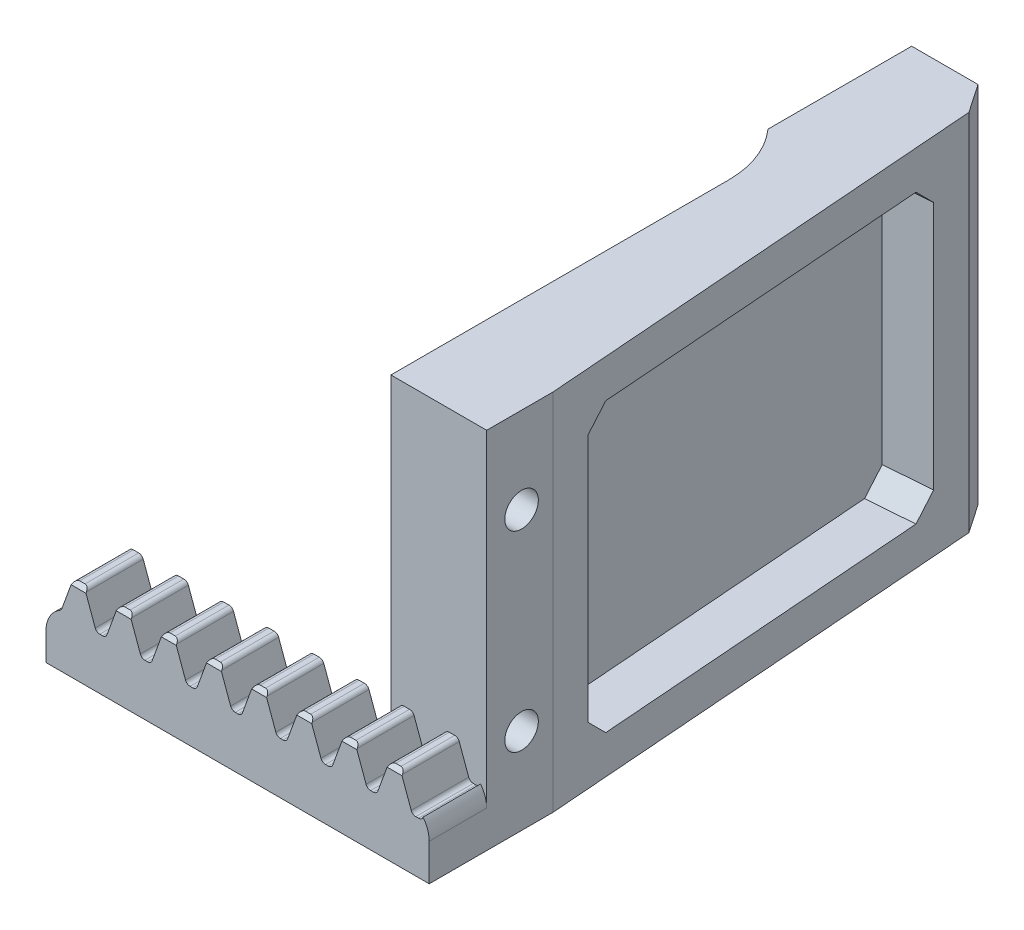
from build123d import *

# Parameters (mm, degrees)
BOSS_EXTRUDE1_DEPTH      = 7.5
BOSS_EXTRUDE1_DEPTH_BACK = 7.5
SKETCH3_W                = 200
SKETCH3_H                = 15
CUT_EXTRUDE1_DEPTH       = 101.560926806
FILLET1_R                = 0.503257554
LPATTERN1_COUNT          = 42
LPATTERN1_PITCH          = 4.71238898
FILLET1_OF_LPATTERN1_R   = 0.503257554
CUT_EXTRUDE2_DEPTH       = 101.560926806
CUT_EXTRUDE2_DEPTH_BACK  = 101.560926806
SKETCH5_W                = 4.71238898
SKETCH5_H                = 3.375
CUT_EXTRUDE3_DEPTH       = 101.560926806
CUT_EXTRUDE3_DEPTH_BACK  = 101.560926806
SKETCH6_W                = 13.890612777
SKETCH6_H                = 21.950597968
CUT_EXTRUDE6_DEPTH       = 101.560926806
CUT_EXTRUDE6_DEPTH_BACK  = 101.560926806
SKETCH8_W                = 175.100830171
SKETCH8_H                = 44.946806771
SKETCH9_W                = 55.501850732
SKETCH9_H                = 10.784038355
CUT_EXTRUDE7_DEPTH       = 101.560926806
SKETCH10_W               = 10
SKETCH10_H               = 38
BOSS_EXTRUDE2_DEPTH      = 6.9
SKETCH11_W               = 12.54
SKETCH11_H               = 38
BOSS_EXTRUDE3_DEPTH      = 50
SKETCH12_W               = 2.54
SKETCH12_H               = 35
CUT_EXTRUDE8_DEPTH       = 121.701325593
CHAMFER1_SIZE            = 3
CHAMFER1_SIZE2           = 1.816762814
FILLET2_R                = 10
SKETCH13_W               = 39.144192087
SKETCH13_H               = 30
CUT_EXTRUDE9_DEPTH       = 5
CHAMFER2_SIZE            = 2
SKETCH14_R               = 1.75
CUT_EXTRUDE10_DEPTH      = 78.944675893
SKETCH15_W               = 75.463673411
SKETCH15_H               = 29.481435093
CUT_EXTRUDE11_DEPTH      = 0.5
FILLET3_R                = 3
CUT_EXTRUDE12_DEPTH      = 78.944675893
CUT_EXTRUDE12_DEPTH_BACK = 78.944675893


with BuildPart() as part:
    # Sketch3 → Boss-Extrude1 (new, two sides: drawn at the far end of the back side and taken through both)
    with BuildSketch(Plane.XY.offset(-BOSS_EXTRUDE1_DEPTH_BACK)):
        Rectangle(SKETCH3_W, SKETCH3_H)
    extrude(amount=BOSS_EXTRUDE1_DEPTH + BOSS_EXTRUDE1_DEPTH_BACK)

    # Sketch4 → Cut-Extrude1 (cut, symmetric)
    with BuildSketch(Plane.XY):
        Polygon((-94.247779608, 7.5), (-94.247779608, 4.125), (-94.743432664, 4.125), (-95.971832204, 7.5), align=None)
        Polygon((-97.236115992, 7.5), (-98.464515532, 4.125), (-98.960168588, 4.125), (-98.960168588, 7.5), align=None)
    cut_extrude1 = extrude(amount=CUT_EXTRUDE1_DEPTH, both=True, mode=Mode.SUBTRACT)

    # Fillet1
    fillet1_edges = [part.edges().sort_by_distance(p)[0] for p in [
        (-95.971832204, 7.5, 0),
        (-94.743432664, 4.125, 0),
        (-97.236115992, 7.5, 0),
        (-98.464515532, 4.125, 0),
    ]]
    fillet(fillet1_edges, radius=FILLET1_R)

    # LPattern1: Cut-Extrude1 ×42
    with Locations(*[(i * LPATTERN1_PITCH, 0, 0) for i in range(1, LPATTERN1_COUNT)]):
        add(cut_extrude1, mode=Mode.SUBTRACT)

    # Fillet1 of LPattern1
    fillet1_of_lpattern1_edges = [part.edges().sort_by_distance(p)[0] for p in [
        (-91.259443224, 7.5, 0),
        (-90.031043683, 4.125, 0),
        (-92.523727011, 7.5, 0),
        (-93.752126552, 4.125, 0),
        (-86.547054243, 7.5, 0),
        (-85.318654703, 4.125, 0),
        (-87.811338031, 7.5, 0),
        (-89.039737571, 4.125, 0),
        (-81.834665263, 7.5, 0),
        (-80.606265722, 4.125, 0),
        (-83.09894905, 7.5, 0),
        (-84.327348591, 4.125, 0),
        (-77.122276283, 7.5, 0),
        (-75.893876742, 4.125, 0),
        (-78.38656007, 7.5, 0),
        (-79.614959611, 4.125, 0),
        (-72.409887302, 7.5, 0),
        (-71.181487762, 4.125, 0),
        (-73.67417109, 7.5, 0),
        (-74.90257063, 4.125, 0),
        (-67.697498322, 7.5, 0),
        (-66.469098781, 4.125, 0),
        (-68.961782109, 7.5, 0),
        (-70.19018165, 4.125, 0),
        (-62.985109342, 7.5, 0),
        (-61.756709801, 4.125, 0),
        (-64.249393129, 7.5, 0),
        (-65.47779267, 4.125, 0),
        (-58.272720361, 7.5, 0),
        (-57.04432082, 4.125, 0),
        (-59.537004149, 7.5, 0),
        (-60.765403689, 4.125, 0),
        (-53.560331381, 7.5, 0),
        (-52.33193184, 4.125, 0),
        (-54.824615168, 7.5, 0),
        (-56.053014709, 4.125, 0),
        (-48.8479424, 7.5, 0),
        (-47.61954286, 4.125, 0),
        (-50.112226188, 7.5, 0),
        (-51.340625728, 4.125, 0),
        (-44.13555342, 7.5, 0),
        (-42.907153879, 4.125, 0),
        (-45.399837207, 7.5, 0),
        (-46.628236748, 4.125, 0),
        (-39.42316444, 7.5, 0),
        (-38.194764899, 4.125, 0),
        (-40.687448227, 7.5, 0),
        (-41.915847768, 4.125, 0),
        (-34.710775459, 7.5, 0),
        (-33.482375919, 4.125, 0),
        (-35.975059247, 7.5, 0),
        (-37.203458787, 4.125, 0),
        (-29.998386479, 7.5, 0),
        (-28.769986938, 4.125, 0),
        (-31.262670266, 7.5, 0),
        (-32.491069807, 4.125, 0),
        (-25.285997498, 7.5, 0),
        (-24.057597958, 4.125, 0),
        (-26.550281286, 7.5, 0),
        (-27.778680826, 4.125, 0),
        (-20.573608518, 7.5, 0),
        (-19.345208977, 4.125, 0),
        (-21.837892305, 7.5, 0),
        (-23.066291846, 4.125, 0),
        (-15.861219538, 7.5, 0),
        (-14.632819997, 4.125, 0),
        (-17.125503325, 7.5, 0),
        (-18.353902866, 4.125, 0),
        (-11.148830557, 7.5, 0),
        (-9.920431017, 4.125, 0),
        (-12.413114345, 7.5, 0),
        (-13.641513885, 4.125, 0),
        (-6.436441577, 7.5, 0),
        (-5.208042036, 4.125, 0),
        (-7.700725364, 7.5, 0),
        (-8.929124905, 4.125, 0),
        (-1.724052597, 7.5, 0),
        (-0.495653056, 4.125, 0),
        (-2.988336384, 7.5, 0),
        (-4.216735925, 4.125, 0),
        (2.988336384, 7.5, 0),
        (4.216735925, 4.125, 0),
        (1.724052596, 7.5, 0),
        (0.495653056, 4.125, 0),
        (7.700725364, 7.5, 0),
        (8.929124905, 4.125, 0),
        (6.436441577, 7.5, 0),
        (5.208042036, 4.125, 0),
        (12.413114345, 7.5, 0),
        (13.641513885, 4.125, 0),
        (11.148830557, 7.5, 0),
        (9.920431017, 4.125, 0),
        (17.125503325, 7.5, 0),
        (18.353902866, 4.125, 0),
        (15.861219538, 7.5, 0),
        (14.632819997, 4.125, 0),
        (21.837892305, 7.5, 0),
        (23.066291846, 4.125, 0),
        (20.573608518, 7.5, 0),
        (19.345208977, 4.125, 0),
        (26.550281286, 7.5, 0),
        (27.778680826, 4.125, 0),
        (25.285997498, 7.5, 0),
        (24.057597958, 4.125, 0),
        (31.262670266, 7.5, 0),
        (32.491069807, 4.125, 0),
        (29.998386479, 7.5, 0),
        (28.769986938, 4.125, 0),
        (35.975059247, 7.5, 0),
        (37.203458787, 4.125, 0),
        (34.710775459, 7.5, 0),
        (33.482375919, 4.125, 0),
        (40.687448227, 7.5, 0),
        (41.915847768, 4.125, 0),
        (39.42316444, 7.5, 0),
        (38.194764899, 4.125, 0),
        (45.399837207, 7.5, 0),
        (46.628236748, 4.125, 0),
        (44.13555342, 7.5, 0),
        (42.907153879, 4.125, 0),
        (50.112226188, 7.5, 0),
        (51.340625728, 4.125, 0),
        (48.8479424, 7.5, 0),
        (47.61954286, 4.125, 0),
        (54.824615168, 7.5, 0),
        (56.053014709, 4.125, 0),
        (53.560331381, 7.5, 0),
        (52.33193184, 4.125, 0),
        (59.537004148, 7.5, 0),
        (60.765403689, 4.125, 0),
        (58.272720361, 7.5, 0),
        (57.04432082, 4.125, 0),
        (64.249393129, 7.5, 0),
        (65.47779267, 4.125, 0),
        (62.985109341, 7.5, 0),
        (61.756709801, 4.125, 0),
        (68.961782109, 7.5, 0),
        (70.19018165, 4.125, 0),
        (67.697498322, 7.5, 0),
        (66.469098781, 4.125, 0),
        (73.67417109, 7.5, 0),
        (74.90257063, 4.125, 0),
        (72.409887302, 7.5, 0),
        (71.181487762, 4.125, 0),
        (78.38656007, 7.5, 0),
        (79.614959611, 4.125, 0),
        (77.122276283, 7.5, 0),
        (75.893876742, 4.125, 0),
        (83.09894905, 7.5, 0),
        (84.327348591, 4.125, 0),
        (81.834665263, 7.5, 0),
        (80.606265722, 4.125, 0),
        (87.811338031, 7.5, 0),
        (89.039737571, 4.125, 0),
        (86.547054243, 7.5, 0),
        (85.318654703, 4.125, 0),
        (92.523727011, 7.5, 0),
        (93.752126552, 4.125, 0),
        (91.259443224, 7.5, 0),
        (90.031043683, 4.125, 0),
        (97.236115992, 7.5, 0),
        (98.464515532, 4.125, 0),
        (95.971832204, 7.5, 0),
        (94.743432664, 4.125, 0),
    ]]
    fillet(fillet1_of_lpattern1_edges, radius=FILLET1_OF_LPATTERN1_R)

    # Sketch5 → Cut-Extrude2 (cut, two sides: drawn at the far end of the back side and taken through both)
    with BuildSketch(Plane.XY.offset(-CUT_EXTRUDE2_DEPTH_BACK)):
        with Locations((-101.316363078, 5.8125)):
            Rectangle(SKETCH5_W, SKETCH5_H)
        with Locations((101.316363078, 5.8125)):
            Rectangle(SKETCH5_W, SKETCH5_H)
    extrude(amount=CUT_EXTRUDE2_DEPTH + CUT_EXTRUDE2_DEPTH_BACK, mode=Mode.SUBTRACT)

    # Sketch6 → Cut-Extrude3 (cut, two sides: drawn at the far end of the back side and taken through both)
    with BuildSketch(Plane(origin=(0, 0, 0), x_dir=(0, 0, -1), z_dir=(1, 0, 0)).offset(-CUT_EXTRUDE3_DEPTH_BACK)):
        with Locations((5.945306389, -0.750264579)):
            Rectangle(SKETCH6_W, SKETCH6_H)
    extrude(amount=CUT_EXTRUDE3_DEPTH + CUT_EXTRUDE3_DEPTH_BACK, mode=Mode.SUBTRACT)

    # Sketch8 → Cut-Extrude6 (cut, two sides: drawn at the far end of the back side and taken through both)
    with BuildSketch(Plane.XY.offset(-CUT_EXTRUDE6_DEPTH_BACK)):
        with Locations((27.550415086, 7.242613414)):
            Rectangle(SKETCH8_W, SKETCH8_H)
    extrude(amount=CUT_EXTRUDE6_DEPTH + CUT_EXTRUDE6_DEPTH_BACK, mode=Mode.SUBTRACT)

    # Sketch9 → Cut-Extrude7 (cut, through all)
    with BuildSketch(Plane.XY):
        with Locations((-76.828993169, -6.642019178)):
            Rectangle(SKETCH9_W, SKETCH9_H)
    extrude(amount=CUT_EXTRUDE7_DEPTH, mode=Mode.SUBTRACT)

    # Sketch10 → Boss-Extrude2 (add)
    with BuildSketch(Plane(origin=(0, 0, 1), x_dir=(-1, 0, 0), z_dir=(0, 0, -1))):
        with Locations((65, 17.75)):
            Rectangle(SKETCH10_W, SKETCH10_H)
    extrude(amount=BOSS_EXTRUDE2_DEPTH)

    # Sketch11 → Boss-Extrude3 (add)
    with BuildSketch(Plane(origin=(0, 0, -5.9), x_dir=(-1, 0, 0), z_dir=(0, 0, -1))):
        with Locations((66.27, 17.75)):
            Rectangle(SKETCH11_W, SKETCH11_H)
    extrude(amount=BOSS_EXTRUDE3_DEPTH)

    # Sketch12 → Cut-Extrude8 (cut, through all)
    with BuildSketch(Plane.XZ.offset(1.25)):
        with Locations((-71.27, -23.4)):
            Rectangle(SKETCH12_W, SKETCH12_H)
        Polygon((-60, -5.9), (-63.8, -55.9), (-60, -55.9), align=None)
    extrude(amount=-CUT_EXTRUDE8_DEPTH, mode=Mode.SUBTRACT)

    # Chamfer1
    chamfer1_edges = [part.edges().sort_by_distance(p)[0] for p in [
        (-63.8, 17.75, -55.9),
    ]]
    chamfer1_side = [part.faces().sort_by_distance(p)[0] for p in [
        (-61.9, 17.75, -30.9),
    ]]
    chamfer(chamfer1_edges, length=CHAMFER1_SIZE, length2=CHAMFER1_SIZE2, reference=chamfer1_side[0])

    # Fillet2
    # the kernel refuses this fillet: 10 mm, written as the material it adds along each edge
    with BuildSketch(Plane(origin=(-70, -1.25, -40.9), x_dir=(-1, 0, 0), z_dir=(0, 1, 0))) as fillet2_piece_1:
        with BuildLine():
            CenterArc((10, 6.659459438), FILLET2_R, 180, 41.754936598)
            Line((0, 6.659459438), (-0.2, 6.659459438))
            Line((-0.2, 6.659459438), (-0.2, 0))
            Line((-0.2, 0), (0, -0.2))
            ThreePointArc((0, -0.2), (1.27, -0.2), (2.3908, -0.133189189))
            Line((2.3908, -0.133189189), (2.54, 0))
        make_face()
    extrude(amount=38)

    # Sketch13 → Cut-Extrude9 (cut)
    with BuildSketch(Plane(origin=(-59.20960532, 0, 4.499930004), x_dir=(-0.07578145826840343, 0, -0.997124450900044), z_dir=(0.997124450900044, 0, -0.07578145826840343))):
        with Locations((34.0020178, 17.75)):
            Rectangle(SKETCH13_W, SKETCH13_H)
    extrude(amount=-CUT_EXTRUDE9_DEPTH, mode=Mode.SUBTRACT)

    # Chamfer2
    chamfer2_edges = [part.edges().sort_by_distance(p)[0] for p in [
        (-62.79593696, 2.75, -9.699044158),
        (-62.79593696, 32.75, -9.699044158),
        (-65.762340919, 32.75, -48.730675198),
        (-65.762340919, 2.75, -48.730675198),
    ]]
    chamfer(chamfer2_edges, length=CHAMFER2_SIZE)

    # Sketch14 → Cut-Extrude10 (cut, through all)
    with BuildSketch(Plane(origin=(-60, 0, 0), x_dir=(0, 0, -1), z_dir=(1, 0, 0))):
        with Locations(Location((2.64, 27.75, 0), (0, 0, 90))):
            Circle(SKETCH14_R)
        with Locations(Location((2.64, 7.75, 0), (0, 0, 90))):
            Circle(SKETCH14_R)
    extrude(amount=-CUT_EXTRUDE10_DEPTH, mode=Mode.SUBTRACT)

    # Sketch15 → Cut-Extrude11 (cut)
    with BuildSketch(Plane.XY.offset(7.5)):
        with Locations((-71.80980664, 4.677610669)):
            Rectangle(SKETCH15_W, SKETCH15_H)
    extrude(amount=-CUT_EXTRUDE11_DEPTH, mode=Mode.SUBTRACT)

    # Fillet3
    # the kernel refuses this fillet: 3 mm, written as the material it takes off along each edge
    with BuildSketch(Plane(origin=(-60, 6.227929353, 1), x_dir=(0, -1, 0), z_dir=(0, 0, 1))) as fillet3_piece_1:
        with BuildLine():
            CenterArc((3.630132521, -3), FILLET3_R, 90, 38.275653288)
            Line((1.77179602, -0.644881012), (0, 0))
            Line((0, 0), (3.630132521, 0))
        make_face()
    extrude(amount=15.075331304, mode=Mode.SUBTRACT)
    with BuildSketch(Plane(origin=(-100, 4.125, -5.230049704), x_dir=(0, -1, 0), z_dir=(0, 0, 1))) as fillet3_piece_2:
        with BuildLine():
            CenterArc((2.492019882, 3), FILLET3_R, 211.240510341, 58.759489659)
            Line((-0.072973462, 1.444105033), (-0.329472796, 1.288515537))
            ThreePointArc((-0.329472796, 1.288515537), (-0.3, 1.183099735), (-0.3, 0))
            Line((-0.3, 0), (0, -0.3))
            Line((0, -0.3), (2.492019882, -0.3))
            Line((2.492019882, -0.3), (2.492019882, 0))
        make_face()
    extrude(amount=18.460099408, mode=Mode.SUBTRACT)

    # Sketch16 → Cut-Extrude12 (cut, two sides: drawn at the far end of the back side and taken through both)
    with BuildSketch(Plane.ZY.offset(100).offset(-CUT_EXTRUDE12_DEPTH_BACK)):
        Polygon((6.6, 7.5), (7, 7.1), (7, 7.5), align=None)
    extrude(amount=CUT_EXTRUDE12_DEPTH + CUT_EXTRUDE12_DEPTH_BACK, mode=Mode.SUBTRACT)


solid = part.part
